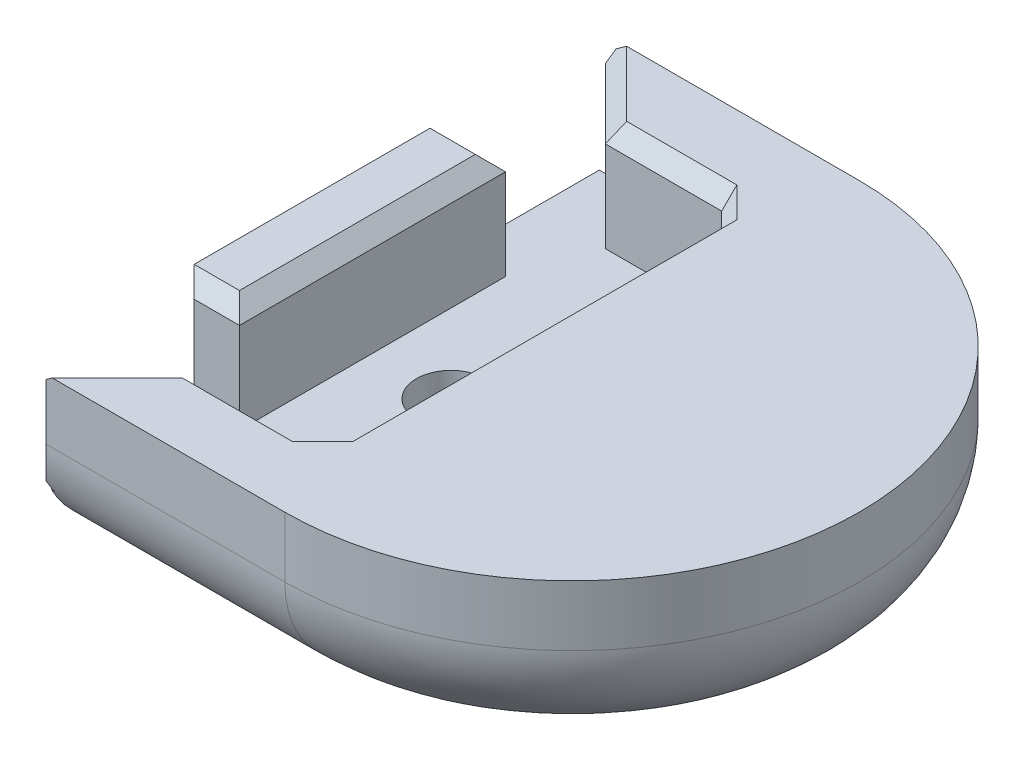
from build123d import *
from OCP.BRepFilletAPI import BRepFilletAPI_MakeChamfer

# Parameters (mm, degrees)
BOSS_EXTRUDE1_DEPTH     = 2
BOSS_EXTRUDE2_START     = 3.5
BOSS_EXTRUDE2_DEPTH     = 3.5
CUT_EXTRUDE1_DEPTH      = 14.883443377
CUT_EXTRUDE1_DEPTH_BACK = 14.883443377
SKETCH4_R               = 1.15
CUT_EXTRUDE2_DEPTH      = 1
CHAMFER1_SIZE           = 0.5
CHAMFER1_SIZE2          = 0.353553391
FILLET1_R               = 3.5
CHAMFER2_SIZE           = 0.5


with BuildPart() as part:
    # Sketch1 → Boss-Extrude1 (new body)
    with BuildSketch(Plane(origin=(0, 0, 0), x_dir=(1, 0, 0), z_dir=(0, 1, 0))):
        with BuildLine():
            Line((-8.6, -4.5), (-8.6, 4.5))
            Line((-8.6, 4.5), (-8.6, 9.5))
            Line((-8.6, 9.5), (0, 9.5))
            ThreePointArc((0, 9.5), (9.5, 0), (0, -9.5))
            Line((0, -9.5), (-8.6, -9.5))
            Line((-8.6, -9.5), (-8.6, -4.5))
        make_face()
    extrude(amount=-BOSS_EXTRUDE1_DEPTH)

    # Sketch2 → Boss-Extrude2 (add)
    with BuildSketch(Plane(origin=(0, 0, 0), x_dir=(1, 0, 0), z_dir=(0, 1, 0)).offset(BOSS_EXTRUDE2_START)):
        Polygon((-8.6, 4.4), (-6.6, 4.4), (-6.6, -4.4), (-8.6, -4.4), (-8.6, 0), align=None)
        with BuildLine():
            Line((-8.4, 9.5), (-5.75, 6.85))
            Line((-5.75, 6.85), (-1.4, 6.85))
            Line((-1.4, 6.85), (-1.4, -6.85))
            Line((-1.4, -6.85), (-5.75, -6.85))
            Line((-5.75, -6.85), (-8.4, -9.5))
            Line((-8.4, -9.5), (0, -9.5))
            ThreePointArc((0, -9.5), (9.5, 0), (0, 9.5))
            Line((0, 9.5), (-8.4, 9.5))
        make_face()
    extrude(amount=-BOSS_EXTRUDE2_DEPTH)

    # Sketch4 → Cut-Extrude1 (cut, two sides: drawn at the far end of the back side and taken through both)
    with BuildSketch(Plane(origin=(0, 0, 0), x_dir=(1, 0, 0), z_dir=(0, 1, 0)).offset(-CUT_EXTRUDE1_DEPTH_BACK)):
        with Locations(Location((-4, 0, 0), (0, 0, 270))):
            Circle(SKETCH4_R)
    extrude(amount=CUT_EXTRUDE1_DEPTH + CUT_EXTRUDE1_DEPTH_BACK, mode=Mode.SUBTRACT)

    # Sketch14 → Cut-Extrude2 (cut)
    with BuildSketch(Plane.XZ.offset(2)):
        Polygon((-5.154700538, 2), (-2.845299462, 2), (-1.690598923, 0), (-2.845299462, -2), (-5.154700538, -2), (-6.309401077, 0), align=None)
    extrude(amount=-CUT_EXTRUDE2_DEPTH, mode=Mode.SUBTRACT)

    # Chamfer1: one chamfer whose edges measure the first distance from different faces: ONE call of the kernel's chamfer builder (chamfer() names one face for all edges)
    chamfer1_edges_1 = [part.edges().sort_by_distance(p)[0] for p in [
        (-8.6, 0, 6.95),
        (-8.6, 1.75, -4.4),
        (-8.6, 1.75, 4.4),
        (-7.6, 3.5, 4.4),
        (-6.6, 3.5, 0),
        (-7.6, 3.5, -4.4),
        (-8.5, 0, -9.5),
        (-1.4, 1.75, -6.85),
        (-1.4, 1.75, 6.85),
        (-7.075, 3.5, -8.175),
        (-3.575, 3.5, -6.85),
        (-1.4, 3.5, 0),
        (-3.575, 3.5, 6.85),
        (-7.075, 3.5, 8.175),
        (-5.732050808, -2, 1),
        (-5.732050808, -2, -1),
        (-4, -2, -2),
        (-2.267949192, -2, -1),
        (-2.267949192, -2, 1),
        (-4, -2, 2),
        (-8.5, 0, 9.5),
        (-8.6, 0, -6.95),
    ]]
    chamfer1_edges_2 = [part.edges().sort_by_distance(p)[0] for p in [
        (-8.4, 1.75, -9.5),
    ]]
    chamfer1_side_2 = [part.faces().sort_by_distance(p)[0] for p in [
        (-7.075, 1.75, -8.175),
    ]]
    chamfer1_edges_3 = [part.edges().sort_by_distance(p)[0] for p in [
        (-8.4, 1.75, 9.5),
    ]]
    chamfer1_side_3 = [part.faces().sort_by_distance(p)[0] for p in [
        (-4.236909871, 0.734978541, 9.5),
    ]]
    chamfer1 = BRepFilletAPI_MakeChamfer(part.part.solid().wrapped)
    for e in chamfer1_edges_1:
        chamfer1.Add(CHAMFER1_SIZE, e.wrapped)
    for e in chamfer1_edges_2:
        chamfer1.Add(CHAMFER1_SIZE, CHAMFER1_SIZE2, e.wrapped, chamfer1_side_2[0].wrapped)  # the first distance lies on this face
    for e in chamfer1_edges_3:
        chamfer1.Add(CHAMFER1_SIZE, CHAMFER1_SIZE2, e.wrapped, chamfer1_side_3[0].wrapped)  # the first distance lies on this face
    add(Compound.cast(chamfer1.Shape()), mode=Mode.REPLACE)

    # Fillet1
    # the kernel refuses this fillet: 3.5 mm, written as the material it takes off along each edge
    with BuildSketch(Plane(origin=(0, -2, 9.5), x_dir=(0, 1, 0), z_dir=(-1, 0, 0))) as fillet1_piece_1:
        with BuildLine():
            CenterArc((FILLET1_R, FILLET1_R), FILLET1_R, 180, 90)
            Line((0, FILLET1_R), (0, 0))
            Line((0, 0), (FILLET1_R, 0))
        make_face()
    extrude(amount=17.35, mode=Mode.SUBTRACT)
    with BuildSketch(Plane(origin=(-17.35, -2, -9.5), x_dir=(0, 0, 1), z_dir=(1, 0, 0))) as fillet1_piece_2:
        with BuildLine():
            CenterArc((FILLET1_R, -FILLET1_R), FILLET1_R, 90, 90)
            Line((0, -FILLET1_R), (0, 0))
            Line((0, 0), (FILLET1_R, 0))
        make_face()
    extrude(amount=17.35, mode=Mode.SUBTRACT)
    with BuildSketch(Plane(origin=(0, -2, 0), x_dir=(0, 0, -1), z_dir=(-1, 0, 0))) as fillet1_piece_3:
        with BuildLine():
            CenterArc((9.5 - FILLET1_R, -FILLET1_R), FILLET1_R, 0, 90)
            Line((9.5, -FILLET1_R), (9.5, 0))
            Line((9.5, 0), (9.5 - FILLET1_R, 0))
        make_face()
    revolve(axis=Axis((0, -2, 0), (0, -1, 0)), revolution_arc=180, mode=Mode.SUBTRACT)

    # Chamfer2
    chamfer2_edges = [part.edges().sort_by_distance(p)[0] for p in [
        (-8.6, -1.602418411, -7.620185175),
        (-8.6, -1.602418411, 7.620185175),
        (-8.6, -2, 0),
    ]]
    chamfer(chamfer2_edges, length=CHAMFER2_SIZE)


solid = part.part
